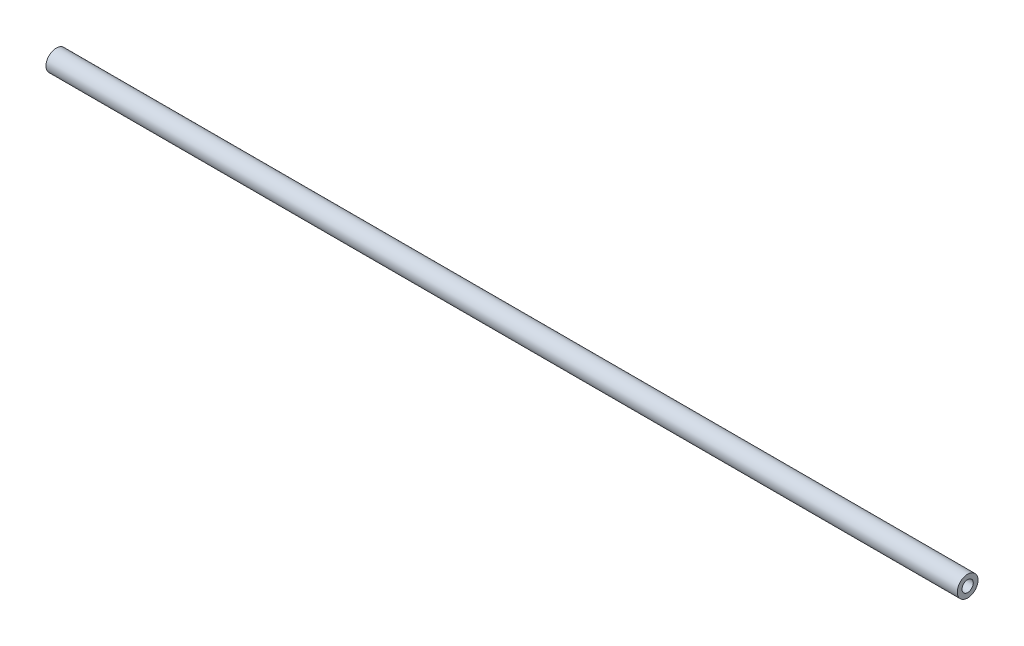
from build123d import *

# Parameters (mm, degrees)
SKETCH1_R           = 3.175
BOSS_EXTRUDE1_DEPTH = 139.7


with BuildPart() as part:
    # Sketch1 → Boss-Extrude1 (new, symmetric)
    with BuildSketch(Plane(origin=(0, 0, 0), x_dir=(0, 0, -1), z_dir=(1, 0, 0))):
        Circle(SKETCH1_R)
    extrude(amount=BOSS_EXTRUDE1_DEPTH, both=True)

    # Sketch4 → Tap Drill for #8-32 Tap1 (revolve, cut)
    with BuildSketch(Plane(origin=(139.7, 0, 0), x_dir=(0, 0, -1), z_dir=(0, 1, 0))):
        Polygon((0, 0), (0, 11.197806461), (1.7272, 10.16), (1.7272, 0), align=None)
    tap_drill_for_8_32_tap1 = revolve(axis=Axis((146.05, 0, 0), (-1, 0, 0)), mode=Mode.SUBTRACT)

    # Mirror1: Tap Drill for #8-32 Tap1 across plane
    add(tap_drill_for_8_32_tap1.mirror(Plane(origin=(0, 0, 0), x_dir=(0, 0, 1), z_dir=(1, 0, 0))), mode=Mode.SUBTRACT)


solid = part.part
